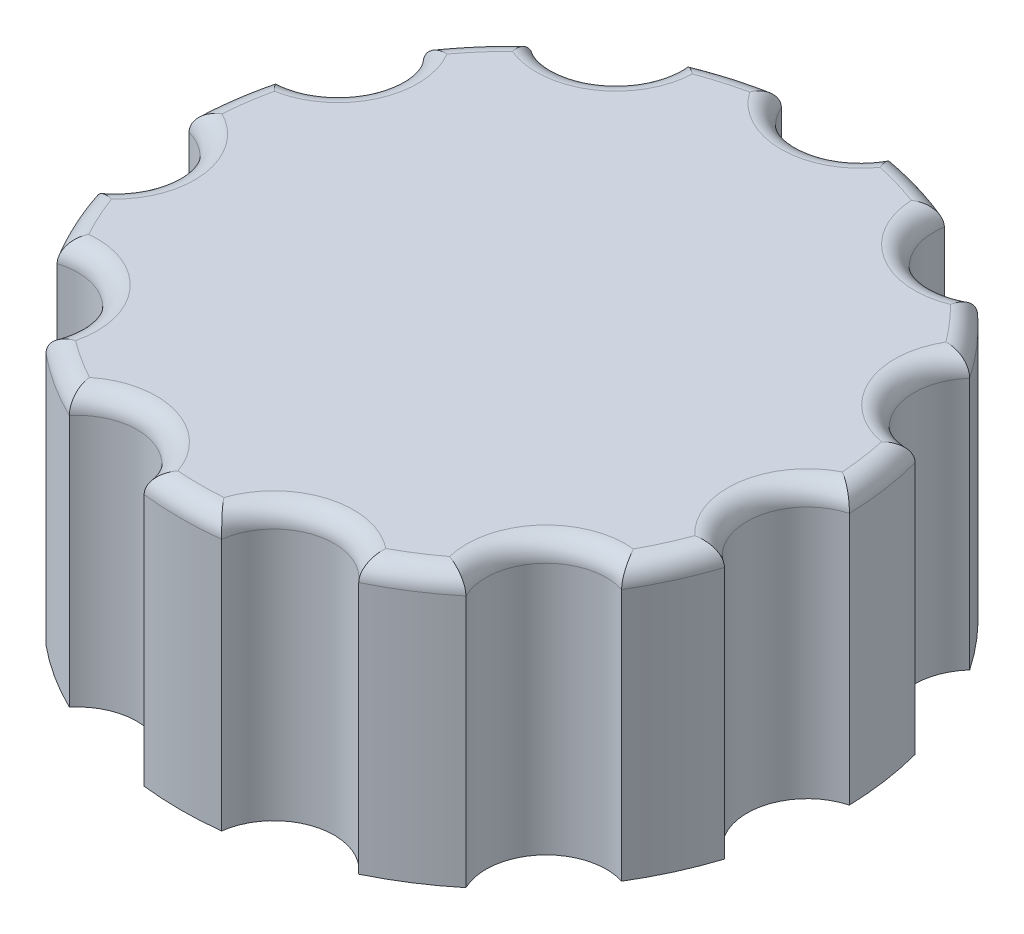
from build123d import *

# Parameters (mm, degrees)
SKETCH1_R           = 3.35
BOSS_EXTRUDE1_DEPTH = 6
BOSS_EXTRUDE2_START = 1
BOSS_EXTRUDE2_DEPTH = 1
FILLET1_R           = 0.5


with BuildPart() as part:
    # Sketch1 → Boss-Extrude1 (new body)
    with BuildSketch(Plane(origin=(0, 0, 0), x_dir=(1, 0, 0), z_dir=(0, 1, 0))):
        with BuildLine():
            ThreePointArc((8.092917998, -2.598976389), (7.374169742, -1.060245545), (8.497314219, 0.213661104))
            ThreePointArc((8.497314219, 0.213661104), (8.413482256, 1.209676125), (8.213308577, 2.188963733))
            ThreePointArc((8.213308577, 2.188963733), (6.776758365, 3.094841847), (7.032881692, 4.773738064))
            ThreePointArc((7.032881692, 4.773738064), (6.423871382, 5.566316239), (5.726031714, 6.281923337))
            ThreePointArc((5.726031714, 6.281923337), (4.02777409, 6.26733882), (3.33555892, 7.818186918))
            ThreePointArc((3.33555892, 7.818186918), (2.394726733, 8.155690276), (1.420780241, 8.380416667))
            ThreePointArc((1.420780241, 8.380416667), (0, 7.45), (-1.420780241, 8.380416667))
            ThreePointArc((-1.420780241, 8.380416667), (-2.394726733, 8.155690276), (-3.33555892, 7.818186918))
            ThreePointArc((-3.33555892, 7.818186918), (-3.32072317, 7.695130338), (-3.315767357, 7.571281795))
            ThreePointArc((-3.315767357, 7.571281795), (-4.134641429, 6.204550338), (-5.726031714, 6.281923337))
            ThreePointArc((-5.726031714, 6.281923337), (-6.423871382, 5.566316239), (-7.032881692, 4.773738064))
            ThreePointArc((-7.032881692, 4.773738064), (-6.739121084, 4.292856172), (-6.636687958, 3.738735117))
            ThreePointArc((-6.636687958, 3.738735117), (-7.100125019, 2.633347864), (-8.213308577, 2.188963733))
            ThreePointArc((-8.213308577, 2.188963733), (-8.413482256, 1.209676125), (-8.497314219, 0.213661104))
            ThreePointArc((-8.497314219, 0.213661104), (-7.675576674, -0.341331569), (-7.358392977, -1.280833544))
            ThreePointArc((-7.358392977, -1.280833544), (-7.554419894, -2.035324692), (-8.092917998, -2.598976389))
            ThreePointArc((-8.092917998, -2.598976389), (-7.731871961, -3.531027611), (-7.26390952, -4.414251747))
            ThreePointArc((-7.26390952, -4.414251747), (-5.883555882, -4.644976572), (-5.251746169, -5.893746606))
            ThreePointArc((-5.251746169, -5.893746606), (-5.29005379, -6.236217262), (-5.403083137, -6.561759871))
            ThreePointArc((-5.403083137, -6.561759871), (-4.595446948, -7.150655029), (-3.724264873, -7.640670858))
            ThreePointArc((-3.724264873, -7.640670858), (-2.098907548, -7.148222653), (-0.997807557, -8.441230958))
            ThreePointArc((-0.997807557, -8.441230958), (0, -8.5), (0.997807557, -8.441230958))
            ThreePointArc((0.997807557, -8.441230958), (2.098907548, -7.148222653), (3.724264873, -7.640670858))
            ThreePointArc((3.724264873, -7.640670858), (4.595446948, -7.150655029), (5.403083137, -6.561759871))
            ThreePointArc((5.403083137, -6.561759871), (5.630334329, -4.878712468), (7.26390952, -4.414251747))
            ThreePointArc((7.26390952, -4.414251747), (7.731871961, -3.531027611), (8.092917998, -2.598976389))
        make_face()
        Circle(SKETCH1_R, mode=Mode.SUBTRACT)
    extrude(amount=-BOSS_EXTRUDE1_DEPTH)

    # Sketch1<2> → Boss-Extrude2 (add)
    with BuildSketch(Plane(origin=(0, 0, 0), x_dir=(1, 0, 0), z_dir=(0, 1, 0)).offset(BOSS_EXTRUDE2_START)):
        with BuildLine():
            ThreePointArc((8.092917998, -2.598976389), (7.374169742, -1.060245545), (8.497314219, 0.213661104))
            ThreePointArc((8.497314219, 0.213661104), (8.413482256, 1.209676125), (8.213308577, 2.188963733))
            ThreePointArc((8.213308577, 2.188963733), (6.776758365, 3.094841847), (7.032881692, 4.773738064))
            ThreePointArc((7.032881692, 4.773738064), (6.423871382, 5.566316239), (5.726031714, 6.281923337))
            ThreePointArc((5.726031714, 6.281923337), (4.02777409, 6.26733882), (3.33555892, 7.818186918))
            ThreePointArc((3.33555892, 7.818186918), (2.394726733, 8.155690276), (1.420780241, 8.380416667))
            ThreePointArc((1.420780241, 8.380416667), (0, 7.45), (-1.420780241, 8.380416667))
            ThreePointArc((-1.420780241, 8.380416667), (-2.394726733, 8.155690276), (-3.33555892, 7.818186918))
            ThreePointArc((-3.33555892, 7.818186918), (-4.02777409, 6.26733882), (-5.726031714, 6.281923337))
            ThreePointArc((-5.726031714, 6.281923337), (-6.423871382, 5.566316239), (-7.032881692, 4.773738064))
            ThreePointArc((-7.032881692, 4.773738064), (-6.776758365, 3.094841847), (-8.213308577, 2.188963733))
            ThreePointArc((-8.213308577, 2.188963733), (-8.413482256, 1.209676125), (-8.497314219, 0.213661104))
            ThreePointArc((-8.497314219, 0.213661104), (-7.374169742, -1.060245545), (-8.092917998, -2.598976389))
            ThreePointArc((-8.092917998, -2.598976389), (-7.731871961, -3.531027611), (-7.26390952, -4.414251747))
            ThreePointArc((-7.26390952, -4.414251747), (-5.630334329, -4.878712468), (-5.403083137, -6.561759871))
            ThreePointArc((-5.403083137, -6.561759871), (-4.595446948, -7.150655029), (-3.724264873, -7.640670858))
            ThreePointArc((-3.724264873, -7.640670858), (-2.098907548, -7.148222653), (-0.997807557, -8.441230958))
            ThreePointArc((-0.997807557, -8.441230958), (0, -8.5), (0.997807557, -8.441230958))
            ThreePointArc((0.997807557, -8.441230958), (2.098907548, -7.148222653), (3.724264873, -7.640670858))
            ThreePointArc((3.724264873, -7.640670858), (4.595446948, -7.150655029), (5.403083137, -6.561759871))
            ThreePointArc((5.403083137, -6.561759871), (5.630334329, -4.878712468), (7.26390952, -4.414251747))
            ThreePointArc((7.26390952, -4.414251747), (7.731871961, -3.531027611), (8.092917998, -2.598976389))
        make_face()
    extrude(amount=-BOSS_EXTRUDE2_DEPTH)

    # Fillet1
    fillet1_edges = [part.edges().sort_by_distance(p)[0] for p in [
        (-2.394726733, 1, -8.155690276),
        (0, 1, -7.45),
        (2.394726733, 1, -8.155690276),
        (4.02777409, 1, -6.26733882),
        (6.423871382, 1, -5.566316239),
        (6.776758365, 1, -3.094841847),
        (8.413482256, 1, -1.209676125),
        (7.374169742, 1, 1.060245545),
        (7.731871961, 1, 3.531027611),
        (5.630334329, 1, 4.878712468),
        (4.595446948, 1, 7.150655029),
        (2.098907548, 1, 7.148222653),
        (0, 1, 8.5),
        (-2.098907548, 1, 7.148222653),
        (-4.595446948, 1, 7.150655029),
        (-5.630334329, 1, 4.878712468),
        (-7.731871961, 1, 3.531027611),
        (-7.374169742, 1, 1.060245545),
        (-8.413482256, 1, -1.209676125),
        (-6.776758365, 1, -3.094841847),
        (-6.423871382, 1, -5.566316239),
        (-4.02777409, 1, -6.26733882),
    ]]
    fillet(fillet1_edges, radius=FILLET1_R)


solid = part.part
